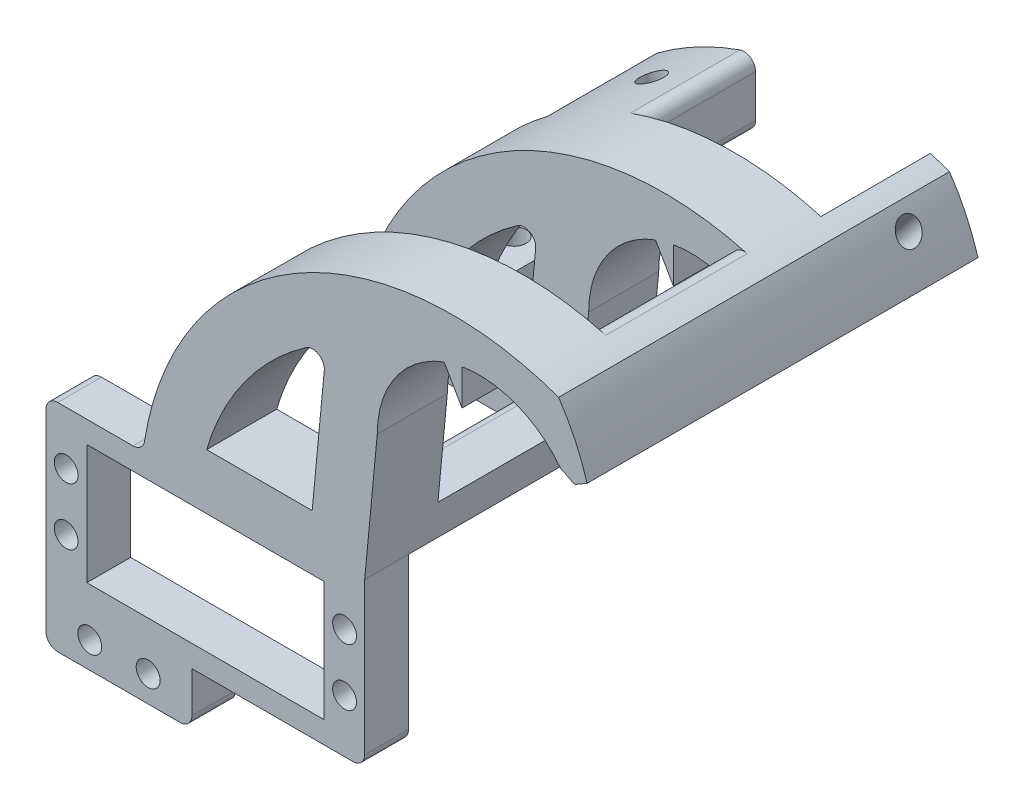
from build123d import *

# Parameters (mm, degrees)
SKETCH2_W           = 54.6
SKETCH2_H           = 28
SKETCH2_R           = 2.04
SKETCH2_W_2         = 40.6
SKETCH2_H_2         = 20.5
BOSS_EXTRUDE1_DEPTH = 7.5
BOSS_EXTRUDE2_DEPTH = 7.5
BOSS_EXTRUDE3_DEPTH = 40.72
SKETCH6_W           = 18.087587328
SKETCH6_H           = 12.11
SKETCH6_W_2         = 10.871882737
CUT_EXTRUDE2_DEPTH  = 75
CUT_EXTRUDE3_DEPTH  = 24.22
FILLET2_START       = -28.72
FILLET2_DEPTH       = 24.22
FILLET2_START_2     = -3.36744
FILLET2_2_DEPTH     = 11.36744
FILLET2_START_3     = -40.72
FILLET2_3_DEPTH     = 12
FILLET2_START_4     = -4.5
FILLET2_4_DEPTH     = 12
FILLET3_R           = 2
SKETCH8_W           = 25
SKETCH8_H           = 9
SKETCH8_R           = 2.05
BOSS_EXTRUDE4_DEPTH = 7.5
BOSS_EXTRUDE5_DEPTH = 18.75
FILLET5_START       = -59.47
FILLET5_DEPTH       = 18.75
FILLET5_START_2     = -40.72
FILLET5_2_DEPTH     = 12
FILLET5_START_3     = -28.72
FILLET5_3_DEPTH     = 36.72
SKETCH10_R          = 2.05
CUT_EXTRUDE4_DEPTH  = 48.75
SKETCH11_R          = 2.05
CUT_EXTRUDE5_DEPTH  = 13.75


with BuildPart() as part:
    # Sketch2 → Boss-Extrude1 (new body)
    with BuildSketch(Plane.XY):
        Rectangle(SKETCH2_W, SKETCH2_H)
        with Locations((23.85, 4.9)):
            Circle(SKETCH2_R, mode=Mode.SUBTRACT)
        with Locations((23.85, -4.9)):
            Circle(SKETCH2_R, mode=Mode.SUBTRACT)
        with Locations((-23.85, -4.9)):
            Circle(SKETCH2_R, mode=Mode.SUBTRACT)
        with Locations((-23.85, 4.9)):
            Circle(SKETCH2_R, mode=Mode.SUBTRACT)
        Rectangle(SKETCH2_W_2, SKETCH2_H_2, mode=Mode.SUBTRACT)
    extrude(amount=BOSS_EXTRUDE1_DEPTH)

    # Sketch3 → Boss-Extrude2 (add)
    with BuildSketch(Plane.XY.offset(7.5)):
        with BuildLine():
            ThreePointArc((60.895347856, 47.266361721), (62.080408935, 46.696685397), (63.247918809, 46.091853548))
            Line((63.247918809, 46.091853548), (65.410652729, 47.340508558))
            ThreePointArc((65.410652729, 47.340508558), (63.367825291, 52.693526286), (60.533352794, 57.672854393))
            ThreePointArc((60.533352794, 57.672854393), (14.45073797, 52.932517239), (-10.655780842, 14))
            Line((-10.655780842, 14), (27.3, 14))
            Line((27.3, 14), (29.456139987, 36.685790659))
            ThreePointArc((29.456139987, 36.685790659), (31.415329504, 44.731485751), (36.854221074, 50.975690388))
            ThreePointArc((36.854221074, 50.975690388), (38.81261709, 52.175562601), (40.911281353, 53.108630977))
            Line((40.911281353, 53.108630977), (43.979720969, 47.793937662))
            Line((43.979720969, 47.793937662), (43.979720969, 53.930816894))
            ThreePointArc((43.979720969, 53.930816894), (53.370921787, 52.967700083), (60.895347856, 47.266361721))
        make_face()
        with BuildLine():
            ThreePointArc((0.216101895, 19.75), (7.968248239, 34.690697157), (20.76316619, 45.627345599))
            Line((20.76316619, 45.627345599), (18.303689223, 19.75))
            Line((18.303689223, 19.75), (0.216101895, 19.75))
        make_face(mode=Mode.SUBTRACT)
    extrude(amount=-BOSS_EXTRUDE2_DEPTH)

    # Sketch4 → Boss-Extrude3 (add)
    with BuildSketch(Plane(origin=(0, 0, 0), x_dir=(-1, 0, 0), z_dir=(0, 0, -1))):
        with BuildLine():
            Line((-27.3, 14), (10.655780842, 14))
            ThreePointArc((10.655780842, 14), (-14.45073797, 52.932517239), (-60.533352794, 57.672854393))
            ThreePointArc((-60.533352794, 57.672854393), (-63.367825291, 52.693526286), (-65.410652729, 47.340508558))
            Line((-65.410652729, 47.340508558), (-63.247918809, 46.091853548))
            ThreePointArc((-63.247918809, 46.091853548), (-62.080408935, 46.696685397), (-60.895347856, 47.266361721))
            ThreePointArc((-60.895347856, 47.266361721), (-53.370921787, 52.967700083), (-43.979720969, 53.930816894))
            Line((-43.979720969, 53.930816894), (-43.979720969, 47.793937662))
            Line((-43.979720969, 47.793937662), (-40.911281353, 53.108630977))
            ThreePointArc((-40.911281353, 53.108630977), (-32.60282981, 46.697408258), (-29.456139987, 36.685790659))
            Line((-29.456139987, 36.685790659), (-27.3, 14))
        make_face()
        with BuildLine():
            ThreePointArc((-20.76316619, 45.627345599), (-7.968248239, 34.690697157), (-0.216101895, 19.75))
            Line((-0.216101895, 19.75), (-18.303689223, 19.75))
            Line((-18.303689223, 19.75), (-20.76316619, 45.627345599))
        make_face(mode=Mode.SUBTRACT)
    extrude(amount=BOSS_EXTRUDE3_DEPTH)

    # Sketch6 → Cut-Extrude2 (cut)
    with BuildSketch(Plane.XZ.offset(-14)):
        with Locations((9.259895559, -22.665)):
            Rectangle(SKETCH6_W, SKETCH6_H)
        with Locations((9.259895559, -10.555)):
            Rectangle(SKETCH6_W, SKETCH6_H)
        with Locations((-5.219839474, -10.555)):
            Rectangle(SKETCH6_W_2, SKETCH6_H)
        with Locations((-5.219839474, -22.665)):
            Rectangle(SKETCH6_W_2, SKETCH6_H)
    extrude(amount=-CUT_EXTRUDE2_DEPTH, mode=Mode.SUBTRACT)

    # Sketch7 → Cut-Extrude3 (cut)
    with BuildSketch(Plane(origin=(0, 0, -4.5), x_dir=(-1, 0, 0), z_dir=(0, 0, -1))):
        Polygon((-18.303689223, 19.75), (-27.846500896, 19.75), (-54.079071881, 47.777058416), (-54.079071881, 65.656726539), (-18.303689223, 62.002487799), align=None)
    extrude(amount=CUT_EXTRUDE3_DEPTH, mode=Mode.SUBTRACT)

    # Fillet2: read off the stored shape, not the designer's step
    # Fillet2 outline → Fillet2 (cut)
    with BuildSketch(Plane.XY.offset(FILLET2_START)):
        with BuildLine():
            ThreePointArc((55.143386559, 52.15249663), (54.365687709, 52.888463891), (54.079071881, 53.920120169))
            Line((54.079071881, 53.920120169), (54.079071881, 52.670590979))
            ThreePointArc((54.079071881, 52.670590979), (54.615611027, 52.420545294), (55.143386559, 52.15249663))
        make_face()
        with BuildLine():
            ThreePointArc((56.609256937, 58.915929333), (55.348001268, 59.246208749), (54.079071881, 59.545655852))
            Line((54.079071881, 59.545655852), (54.079071881, 56.987483377))
            ThreePointArc((54.079071881, 56.987483377), (54.866712634, 58.57813892), (56.609256937, 58.915929333))
        make_face()
        with BuildLine():
            Line((18.303689223, 19.75), (18.303689223, 17.75))
            ThreePointArc((18.303689223, 17.75), (18.88947566, 19.164213562), (20.303689223, 19.75))
            Line((20.303689223, 19.75), (18.303689223, 19.75))
        make_face()
    extrude(amount=FILLET2_DEPTH, mode=Mode.SUBTRACT)

    # Fillet2 2 outline → Fillet2 2 (cut)
    with BuildSketch(Plane.XY.offset(FILLET2_START_2)):
        with BuildLine():
            Line((-27.3, 14), (-27.3, 12))
            ThreePointArc((-27.3, 12), (-26.714213562, 13.414213562), (-25.3, 14))
            Line((-25.3, 14), (-27.3, 14))
        make_face()
        with BuildLine():
            ThreePointArc((27.3, -12), (26.714213562, -13.414213562), (25.3, -14))
            Line((25.3, -14), (27.3, -14))
            Line((27.3, -14), (27.3, -12))
        make_face()
    extrude(amount=FILLET2_2_DEPTH, mode=Mode.SUBTRACT)

    # Fillet2 3 outline → Fillet2 3 (add)
    with BuildSketch(Plane.XY.offset(FILLET2_START_3)):
        with BuildLine():
            ThreePointArc((17.242809806, 43.409998621), (19.395297177, 43.497545876), (20.378564388, 41.5807642))
            Line((20.378564388, 41.5807642), (20.76316619, 45.627345599))
            ThreePointArc((20.76316619, 45.627345599), (18.976765346, 44.560304331), (17.242809806, 43.409998621))
        make_face()
    extrude(amount=FILLET2_3_DEPTH)

    # Fillet2 4 outline → Fillet2 4 (add)
    with BuildSketch(Plane.XY.offset(FILLET2_START_4)):
        with BuildLine():
            ThreePointArc((17.242809806, 43.409998621), (19.395297177, 43.497545876), (20.378564388, 41.5807642))
            Line((20.378564388, 41.5807642), (20.76316619, 45.627345599))
            ThreePointArc((20.76316619, 45.627345599), (18.976765346, 44.560304331), (17.242809806, 43.409998621))
        make_face()
    extrude(amount=FILLET2_4_DEPTH)

    # Fillet3
    fillet3_edges = [part.edges().sort_by_distance(p)[0] for p in [
        (-10.655780842, 14, 3.75),
    ]]
    fillet(fillet3_edges, radius=FILLET3_R)

    # Sketch8 → Boss-Extrude4 (add)
    with BuildSketch(Plane(origin=(0, 0, 0), x_dir=(-1, 0, 0), z_dir=(0, 0, -1))):
        with Locations((14.8, -18.5)):
            Rectangle(SKETCH8_W, SKETCH8_H)
        with Locations((19.8, -18.5)):
            Circle(SKETCH8_R, mode=Mode.SUBTRACT)
        with Locations(Location((9.8, -18.5, 0), (0, 0, 180))):
            Circle(SKETCH8_R, mode=Mode.SUBTRACT)
    extrude(amount=-BOSS_EXTRUDE4_DEPTH)

    # Sketch9 → Boss-Extrude5 (add)
    with BuildSketch(Plane(origin=(0, 0, -40.72), x_dir=(-1, 0, 0), z_dir=(0, 0, -1))):
        with BuildLine():
            Line((9.611579134, 19.75), (-0.216101895, 19.75))
            Line((-0.216101895, 19.75), (-0.216101895, 14))
            Line((-0.216101895, 14), (10.655780842, 14))
            ThreePointArc((10.655780842, 14), (10.212250908, 16.889268502), (9.611579134, 19.75))
        make_face()
        with BuildLine():
            Line((-27.3, 46.646953525), (-6.144205282, 46.646953525))
            ThreePointArc((-6.144205282, 46.646953525), (-16.03112882, 53.865128552), (-27.3, 58.646953525))
            Line((-27.3, 58.646953525), (-27.3, 46.646953525))
        make_face()
        with BuildLine():
            Line((-54.351959568, 52.546176932), (-57.239489727, 58.738505342))
            ThreePointArc((-57.239489727, 58.738505342), (-58.895043232, 58.232329863), (-60.533352794, 57.672854393))
            ThreePointArc((-60.533352794, 57.672854393), (-63.367825291, 52.693526286), (-65.410652729, 47.340508558))
            Line((-65.410652729, 47.340508558), (-63.247918809, 46.091853548))
            ThreePointArc((-63.247918809, 46.091853548), (-62.080408935, 46.696685397), (-60.895347856, 47.266361721))
            ThreePointArc((-60.895347856, 47.266361721), (-57.945451214, 50.305079876), (-54.351959568, 52.546176932))
        make_face()
    extrude(amount=BOSS_EXTRUDE5_DEPTH)

    # Fillet5: read off the stored shape, not the designer's step
    # Fillet5 outline → Fillet5 (cut)
    with BuildSketch(Plane.XY.offset(FILLET5_START)):
        with BuildLine():
            ThreePointArc((-8.338152673, 14), (-9.866779191, 14.710309738), (-10.309607406, 16.336699029))
            ThreePointArc((-10.309607406, 16.336699029), (-10.49559232, 15.170260335), (-10.655780842, 14))
            Line((-10.655780842, 14), (-8.338152673, 14))
        make_face()
        with BuildLine():
            ThreePointArc((10.489442502, 50.25149541), (8.269243735, 48.506581845), (6.144205282, 46.646953525))
            Line((6.144205282, 46.646953525), (11.683362659, 46.646953525))
            ThreePointArc((11.683362659, 46.646953525), (9.784799548, 48.018098919), (10.489442502, 50.25149541))
        make_face()
        with BuildLine():
            ThreePointArc((-9.96667316, 18.154660194), (-9.271106016, 19.30069668), (-8.008038399, 19.75))
            Line((-8.008038399, 19.75), (-9.611579134, 19.75))
            ThreePointArc((-9.611579134, 19.75), (-9.795218542, 18.953686155), (-9.96667316, 18.154660194))
        make_face()
        with BuildLine():
            ThreePointArc((27.3, 58.646953525), (25.961797954, 58.233374024), (24.634881293, 57.784904523))
            ThreePointArc((24.634881293, 57.784904523), (26.45537063, 57.531258997), (27.3, 55.898739868))
            Line((27.3, 55.898739868), (27.3, 58.646953525))
        make_face()
        with BuildLine():
            ThreePointArc((27.3, 48.646953525), (26.714213562, 47.232739963), (25.3, 46.646953525))
            Line((25.3, 46.646953525), (27.3, 46.646953525))
            Line((27.3, 46.646953525), (27.3, 48.646953525))
        make_face()
    extrude(amount=FILLET5_DEPTH, mode=Mode.SUBTRACT)

    # Fillet5 2 outline → Fillet5 2 (cut)
    with BuildSketch(Plane.XY.offset(FILLET5_START_2)):
        with BuildLine():
            ThreePointArc((-8.338152673, 14), (-9.866779191, 14.710309738), (-10.309607406, 16.336699029))
            ThreePointArc((-10.309607406, 16.336699029), (-10.49559232, 15.170260335), (-10.655780842, 14))
            Line((-10.655780842, 14), (-8.338152673, 14))
        make_face()
    extrude(amount=FILLET5_2_DEPTH, mode=Mode.SUBTRACT)

    # Fillet5 3 outline → Fillet5 3 (cut)
    with BuildSketch(Plane.XY.offset(FILLET5_START_3)):
        with BuildLine():
            Line((-2.3, -23), (-2.3, -21))
            ThreePointArc((-2.3, -21), (-2.885786438, -22.414213562), (-4.3, -23))
            Line((-4.3, -23), (-2.3, -23))
        make_face()
        with BuildLine():
            Line((-27.3, -23), (-25.3, -23))
            ThreePointArc((-25.3, -23), (-26.714213562, -22.414213562), (-27.3, -21))
            Line((-27.3, -21), (-27.3, -23))
        make_face()
    extrude(amount=FILLET5_3_DEPTH, mode=Mode.SUBTRACT)

    # Sketch10 → Cut-Extrude4 (cut)
    with BuildSketch(Plane.XZ.offset(-14)):
        with Locations((-5.061025389, -50.47)):
            Circle(SKETCH10_R)
        with Locations((18.491681329, -50.47)):
            Circle(SKETCH10_R)
    extrude(amount=-CUT_EXTRUDE4_DEPTH, mode=Mode.SUBTRACT)

    # Sketch11 → Cut-Extrude5 (cut)
    with BuildSketch(Plane(origin=(47.112556242, 58.387601913, 0), x_dir=(-0.7782450980918282, 0.6279606415182729, 0), z_dir=(-0.6279606415182729, -0.7782450980918282, 0))):
        with Locations(Location((-14.561184245, 50.47, 0), (0, 0, 180))):
            Circle(SKETCH11_R)
    extrude(amount=-CUT_EXTRUDE5_DEPTH, mode=Mode.SUBTRACT)


solid = part.part
